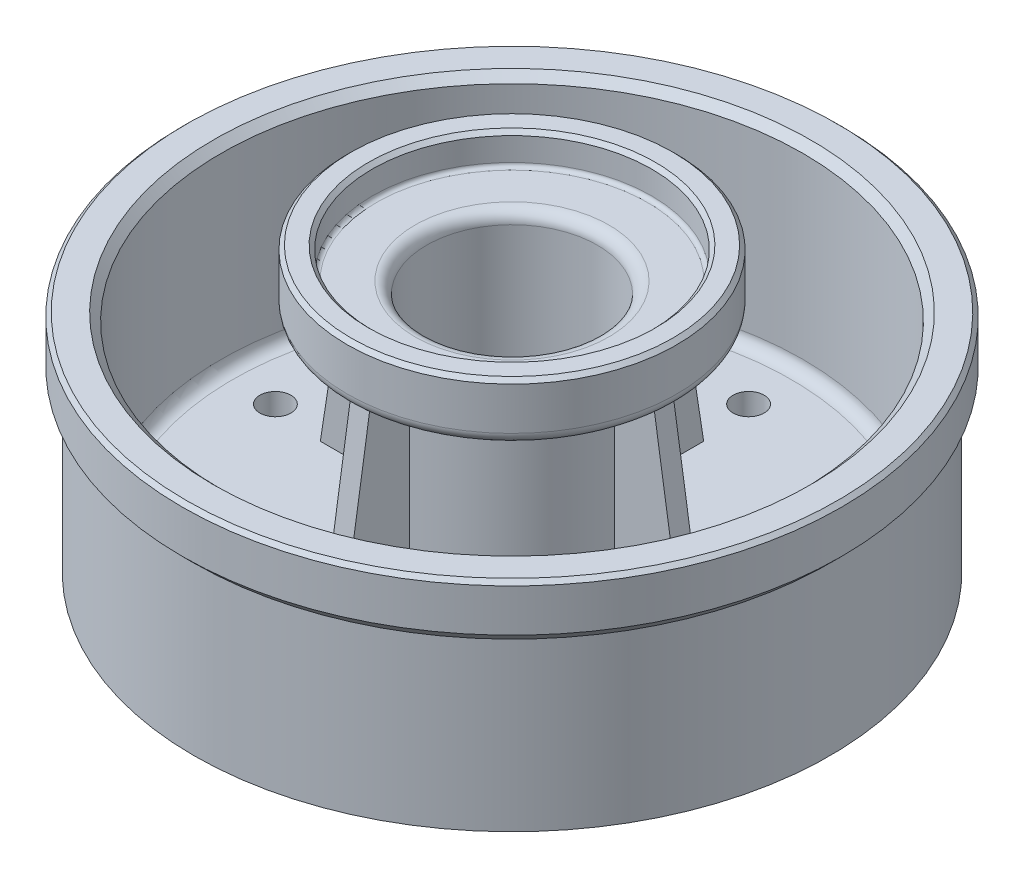
from build123d import *

# Parameters (mm, degrees)
SKETCH2_R                = 82
BOSS_EXTRUDE1_DEPTH      = 43
SKETCH3_R                = 85
BOSS_EXTRUDE2_DEPTH      = 15
SKETCH4_R                = 75
CUT_EXTRUDE1_DEPTH       = 51
SKETCH5_R                = 29
BOSS_EXTRUDE3_DEPTH      = 51
SKETCH6_R                = 42.5
BOSS_EXTRUDE4_DEPTH      = 15
SKETCH7_R                = 36
CUT_EXTRUDE6_DEPTH       = 8
SKETCH7_5_R              = 22
CUT_EXTRUDE7_DEPTH       = 141.637832748
CHAMFER1_SIZE            = 1
CHAMFER2_SIZE            = 2
FILLET1_R                = 3
CHAMFER3_SIZE            = 3
FILLET2_R                = 1
BOSS_EXTRUDE8_REACH      = 172.111
BOSS_EXTRUDE8_END_RADIUS = 29
SKETCH11_W               = 5
SKETCH11_H               = 57.448716419
CIRPATTERN2_COUNT        = 4
SKETCH16_R               = 4
CUT_EXTRUDE9_DEPTH       = 138.134970011


with BuildPart() as part:
    # Sketch2 → Boss-Extrude1 (new body)
    with BuildSketch(Plane(origin=(0, 0, 0), x_dir=(1, 0, 0), z_dir=(0, 1, 0))):
        with Locations(Location((0, 0, 0), (0, 0, 270))):
            Circle(SKETCH2_R)
    extrude(amount=BOSS_EXTRUDE1_DEPTH)

    # Sketch3 → Boss-Extrude2 (add)
    with BuildSketch(Plane(origin=(0, 43, 0), x_dir=(1, 0, 0), z_dir=(0, 1, 0))):
        with Locations(Location((0, 0, 0), (0, 0, 270))):
            Circle(SKETCH3_R)
    extrude(amount=BOSS_EXTRUDE2_DEPTH)

    # Sketch4 → Cut-Extrude1 (cut)
    with BuildSketch(Plane(origin=(0, 58, 0), x_dir=(1, 0, 0), z_dir=(0, 1, 0))):
        with Locations(Location((0, 0, 0), (0, 0, 270))):
            Circle(SKETCH4_R)
    extrude(amount=-CUT_EXTRUDE1_DEPTH, mode=Mode.SUBTRACT)

    # Sketch5 → Boss-Extrude3 (add)
    with BuildSketch(Plane(origin=(0, 7, 0), x_dir=(1, 0, 0), z_dir=(0, 1, 0))):
        with Locations(Location((0, 0, 0), (0, 0, 270))):
            Circle(SKETCH5_R)
    extrude(amount=BOSS_EXTRUDE3_DEPTH)

    # Sketch6 → Boss-Extrude4 (add)
    with BuildSketch(Plane(origin=(0, 58, 0), x_dir=(1, 0, 0), z_dir=(0, 1, 0))):
        with Locations(Location((0, 0, 0), (0, 0, 270))):
            Circle(SKETCH6_R)
    extrude(amount=BOSS_EXTRUDE4_DEPTH)

    # Sketch7 → Cut-Extrude6 (cut)
    with BuildSketch(Plane(origin=(0, 73, 0), x_dir=(1, 0, 0), z_dir=(0, 1, 0))):
        with Locations(Location((0, 0, 0), (0, 0, 270))):
            Circle(SKETCH7_R)
    extrude(amount=-CUT_EXTRUDE6_DEPTH, mode=Mode.SUBTRACT)

    # Sketch7<5> → Cut-Extrude7 (cut, through all)
    with BuildSketch(Plane(origin=(0, 73, 0), x_dir=(1, 0, 0), z_dir=(0, 1, 0))):
        with Locations(Location((0, 0, 0), (0, 0, 270))):
            Circle(SKETCH7_5_R)
    extrude(amount=-CUT_EXTRUDE7_DEPTH, mode=Mode.SUBTRACT)

    # Chamfer1
    chamfer1_edges = [part.edges().sort_by_distance(p)[0] for p in [
        (0, 73, -42.5),
        (0, 73, -36),
        (0, 58, -85),
    ]]
    chamfer(chamfer1_edges, length=CHAMFER1_SIZE)

    # Chamfer2
    chamfer2_edges = [part.edges().sort_by_distance(p)[0] for p in [
        (0, 58, -75),
    ]]
    chamfer(chamfer2_edges, length=CHAMFER2_SIZE)

    # Fillet1
    fillet1_edges = [part.edges().sort_by_distance(p)[0] for p in [
        (0, 7, -75),
        (0, 7, -29),
        (0, 58, -29),
        (0, 58, -42.5),
        (0, 65, -22),
        (0, 0, -22),
    ]]
    fillet(fillet1_edges, radius=FILLET1_R)

    # Chamfer3
    chamfer3_edges = [part.edges().sort_by_distance(p)[0] for p in [
        (0, 43, -85),
    ]]
    chamfer(chamfer3_edges, length=CHAMFER3_SIZE - 0.0001)  # a hair under: the kernel refuses the full size

    # Fillet2
    fillet2_edges = [part.edges().sort_by_distance(p)[0] for p in [
        (0, 65, -36),
    ]]
    fillet(fillet2_edges, radius=FILLET2_R)

    # Boss-Extrude8: up to this cylinder (the profile starts outside it)
    boss_extrude8_end = Plane(origin=(0, 34.271481, 0), z_dir=(0, -1, 0)) * Cylinder(BOSS_EXTRUDE8_END_RADIUS, 403.222, mode=Mode.PRIVATE)
    # Sketch11 → Boss-Extrude8 (add, up to the surface)
    with BuildSketch(Plane(origin=(-46.875350784, 7.260738703, 0), x_dir=(0, 0, -1), z_dir=(0.9882154663822585, -0.1530692392445181, 0)), mode=Mode.PRIVATE) as boss_extrude8_sk1:
        with Locations((0, 27.332847157)):
            Rectangle(SKETCH11_W, SKETCH11_H)
    boss_extrude8_tool1 = extrude(boss_extrude8_sk1.sketch, amount=BOSS_EXTRUDE8_REACH, mode=Mode.PRIVATE) - boss_extrude8_end
    boss_extrude8 = boss_extrude8_tool1.solids().sort_by_distance((-42.691533, 34.271481, 0))[0]
    add(boss_extrude8)

    # CirPattern2: Boss-Extrude8 ×4 about axis
    cirpattern2_axis = Axis((0, 0, 0), (0, 1, 0))
    for i in range(1, CIRPATTERN2_COUNT):
        add(boss_extrude8.rotate(cirpattern2_axis, i * 360 / CIRPATTERN2_COUNT))

    # Sketch16 → Cut-Extrude9 (cut, through all)
    with BuildSketch(Plane(origin=(0, 7, 0), x_dir=(1, 0, 0), z_dir=(0, 1, 0))):
        with Locations(Location((-61, 0, 0), (0, 0, 270))):
            Circle(SKETCH16_R)
        with Locations(Location((-43.133513652, 43.133513652, 0), (0, 0, 270))):
            Circle(SKETCH16_R)
        with Locations(Location((0, 61, 0), (0, 0, 270))):
            Circle(SKETCH16_R)
        with Locations(Location((43.133513652, 43.133513652, 0), (0, 0, 270))):
            Circle(SKETCH16_R)
        with Locations(Location((61, 0, 0), (0, 0, 270))):
            Circle(SKETCH16_R)
        with Locations(Location((43.133513652, -43.133513652, 0), (0, 0, 270))):
            Circle(SKETCH16_R)
        with Locations(Location((0, -61, 0), (0, 0, 270))):
            Circle(SKETCH16_R)
        with Locations(Location((-43.133513652, -43.133513652, 0), (0, 0, 270))):
            Circle(SKETCH16_R)
    extrude(amount=-CUT_EXTRUDE9_DEPTH, mode=Mode.SUBTRACT)


solid = part.part
